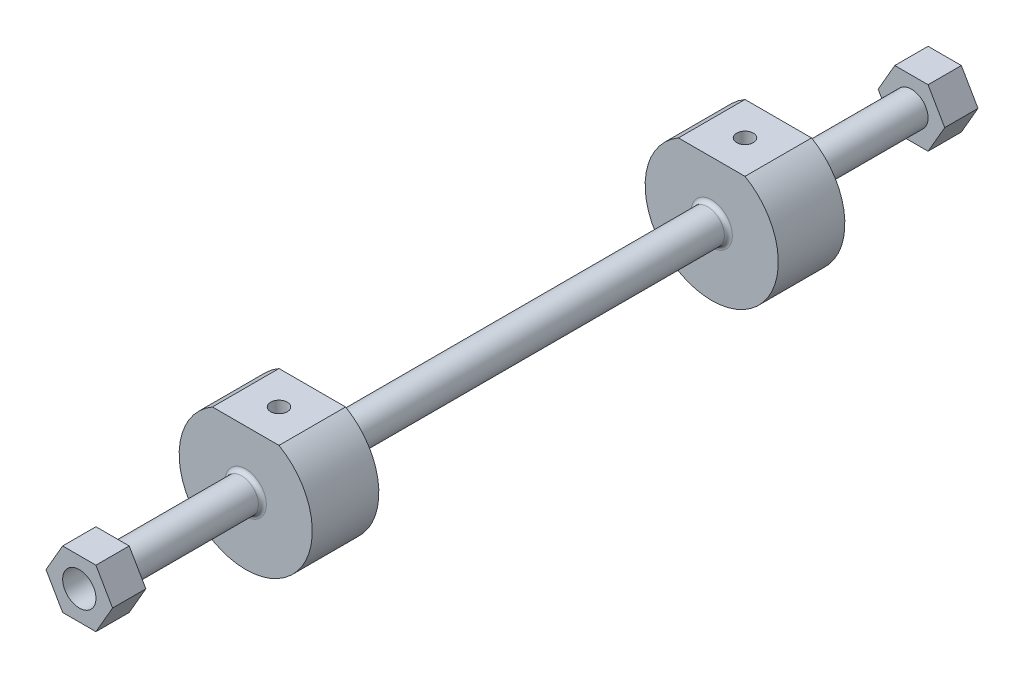
from build123d import *
from OCP.BRepAlgoAPI import BRepAlgoAPI_Cut
from OCP.TopTools import TopTools_ListOfShape

# Parameters (mm, degrees)
SKETCH1_R           = 6.35
BOSS_EXTRUDE1_DEPTH = 152.4
BOSS_EXTRUDE2_DEPTH = 12.7
SKETCH3_R           = 6.35
CUT_EXTRUDE1_DEPTH  = 12.7
BOSS_EXTRUDE3_DEPTH = 25.4
SKETCH5_R           = 3.175
CUT_EXTRUDE2_DEPTH  = 19.05
MIRROR1_START       = -101.6
MIRROR1_OUTLINE_R   = 6.35
MIRROR1_DEPTH       = 25.4
MIRROR1_START_2     = -165.1
MIRROR1_2_DEPTH     = 12.7
MIRROR1_START_3     = 5.499260123
MIRROR1_3_OUTLINE_R = 3.175
MIRROR1_3_DEPTH     = 16.497785133
MIRROR1_START_4     = -93
MIRROR1_4_DEPTH     = 7.275
FILLET1_R           = 1.524
SKETCH6_R           = 6.35
CUT_EXTRUDE5_DEPTH  = 12.7


with BuildPart() as part:
    # Sketch1 → Boss-Extrude1 (new, symmetric)
    with BuildSketch(Plane.XY):
        with Locations(Location((0, 0, 0), (0, 0, 180))):
            Circle(SKETCH1_R)
    extrude(amount=BOSS_EXTRUDE1_DEPTH, both=True)

    # Sketch2 → Boss-Extrude2 (add)
    with BuildSketch(Plane.XY.offset(152.4)):
        Polygon((6.35, -10.998522628), (12.7, 0), (6.35, 10.998522628), (-6.35, 10.998522628), (-12.7, 0), (-6.35, -10.998522628), align=None)
    extrude(amount=BOSS_EXTRUDE2_DEPTH)

    # Sketch3 → Cut-Extrude1 (cut)
    with BuildSketch(Plane.XY.offset(165.1)):
        with Locations(Location((0, 0, 0), (0, 0, 180))):
            Circle(SKETCH3_R)
    extrude(amount=-CUT_EXTRUDE1_DEPTH, mode=Mode.SUBTRACT)


with BuildPart() as cut_extrude1_piece_1:
    # of the separate pieces the step leaves, piece 1, a body of its own (cut_extrude1_pieces)
    add(part.part.solids().sort_by_distance((-6.35, 0, -152.4))[0])

    # Sketch4 → Boss-Extrude3 (add)
    with BuildSketch(Plane.XY.offset(76.2)):
        with BuildLine():
            Line((-12.7, 21.997045256), (12.7, 21.997045256))
            ThreePointArc((12.7, 21.997045256), (0, -25.4), (-12.7, 21.997045256))
        make_face()
    extrude(amount=BOSS_EXTRUDE3_DEPTH)

    # Sketch5 → Cut-Extrude2 (cut)
    with BuildSketch(Plane(origin=(0, 21.997045256, 0), x_dir=(1, 0, 0), z_dir=(0, 1, 0))):
        with Locations(Location((0, -88.9, 0), (0, 0, 270))):
            Circle(SKETCH5_R)
    extrude(amount=-CUT_EXTRUDE2_DEPTH, mode=Mode.SUBTRACT)


with BuildPart() as cut_extrude1_piece_2:
    # of the separate pieces the step leaves, piece 2, a body of its own (cut_extrude1_pieces)
    add(part.part.solids().sort_by_distance((6.35, -10.998522628, 152.4))[0])


with BuildPart() as mirror1_tool:
    # Mirror1: read off the stored shape, not the designer's step
    # Mirror1 outline → Mirror1 (new body)
    with BuildSketch(Plane.XY.offset(MIRROR1_START)):
        with BuildLine():
            Line((12.7, 21.997045256), (-12.7, 21.997045256))
            ThreePointArc((-12.7, 21.997045256), (0, -25.4), (12.7, 21.997045256))
        make_face()
        Circle(MIRROR1_OUTLINE_R, mode=Mode.SUBTRACT)
    extrude(amount=MIRROR1_DEPTH)


with BuildPart() as cut_extrude1_piece_1_1:
    add(cut_extrude1_piece_1.part)


with BuildPart() as cut_extrude1_piece_1_2:
    # Mirror1: joined with mirror1_tool
    add(cut_extrude1_piece_1_1.part.fuse(mirror1_tool.part, tol=0.00001))


with BuildPart() as mirror1_2_tool:
    # Mirror1 2 outline → Mirror1 2 (new body)
    with BuildSketch(Plane.XY.offset(MIRROR1_START_2)):
        Polygon((-12.7, 0), (-6.35, -10.998522628), (6.35, -10.998522628), (12.7, 0), (6.35, 10.998522628), (-6.35, 10.998522628), align=None)
    extrude(amount=MIRROR1_2_DEPTH)


with BuildPart() as cut_extrude1_piece_1_3:
    add(cut_extrude1_piece_1_2.part)


with BuildPart() as cut_extrude1_piece_1_4:
    # Mirror1 2: joined with mirror1_2_tool
    add(cut_extrude1_piece_1_3.part.fuse(mirror1_2_tool.part, tol=0.00001))


with BuildPart() as mirror1_3_tool:
    # Mirror1 3 outline → Mirror1 3 (new body)
    with BuildSketch(Plane(origin=(0, 0, 0), x_dir=(1, 0, 0), z_dir=(0, 1, 0)).offset(MIRROR1_START_3)):
        with Locations((0, 88.9)):
            Circle(MIRROR1_3_OUTLINE_R)
    extrude(amount=MIRROR1_3_DEPTH)


with BuildPart() as cut_extrude1_piece_1_5:
    add(cut_extrude1_piece_1_4.part)

    # Mirror1 3: cut by mirror1_3_tool, with a tolerance
    mirror1_3_stock = TopTools_ListOfShape()
    mirror1_3_stock.Append(cut_extrude1_piece_1_5.part.wrapped)
    mirror1_3_tools = TopTools_ListOfShape()
    mirror1_3_tools.Append(mirror1_3_tool.part.wrapped)
    mirror1_3_cut = BRepAlgoAPI_Cut()
    mirror1_3_cut.SetArguments(mirror1_3_stock)
    mirror1_3_cut.SetTools(mirror1_3_tools)
    mirror1_3_cut.SetFuzzyValue(0.00001)
    mirror1_3_cut.Build()
    add(Compound.cast(mirror1_3_cut.Shape()).solids(), mode=Mode.REPLACE)


with BuildPart() as mirror1_4_tool:
    # Mirror1 4 outline → Mirror1 4 (new body)
    with BuildSketch(Plane.XY.offset(MIRROR1_START_4)):
        with BuildLine():
            ThreePointArc((3.175000516, 5.499261016), (0, 6.35), (-3.175000515, 5.499261016))
            Line((-3.175000515, 5.499261016), (3.175000516, 5.499261016))
        make_face()
    extrude(amount=MIRROR1_4_DEPTH)


with BuildPart() as cut_extrude1_piece_1_6:
    add(cut_extrude1_piece_1_5.part)


with BuildPart() as cut_extrude1_piece_1_7:
    # Mirror1 4: joined with mirror1_4_tool
    add(cut_extrude1_piece_1_6.part.fuse(mirror1_4_tool.part, tol=0.00001))

    # Fillet1
    fillet1_edges = [cut_extrude1_piece_1_7.edges().sort_by_distance(p)[0] for p in [
        (6.35, 0, -76.2),
        (6.35, 0, -101.6),
        (6.35, 0, 76.2),
        (6.35, 0, 101.6),
    ]]
    fillet(fillet1_edges, radius=FILLET1_R)

    # Sketch6 → Cut-Extrude5 (cut)
    with BuildSketch(Plane(origin=(0, 0, -165.1), x_dir=(-1, 0, 0), z_dir=(0, 0, -1))):
        Circle(SKETCH6_R)
    extrude(amount=-CUT_EXTRUDE5_DEPTH, mode=Mode.SUBTRACT)


with BuildPart() as cut_extrude5_piece_1:
    # of the separate pieces the step leaves, piece 1, a body of its own (cut_extrude5_pieces)
    add(cut_extrude1_piece_1_7.part.solids().sort_by_distance((-6.35, 0, -103.124))[0])


with BuildPart() as cut_extrude5_piece_2:
    # of the separate pieces the step leaves, piece 2, a body of its own (cut_extrude5_pieces)
    add(cut_extrude1_piece_1_7.part.solids().sort_by_distance((-12.7, 0, -152.4))[0])


solid = Compound([cut_extrude1_piece_2.part, cut_extrude5_piece_1.part, cut_extrude5_piece_2.part])
